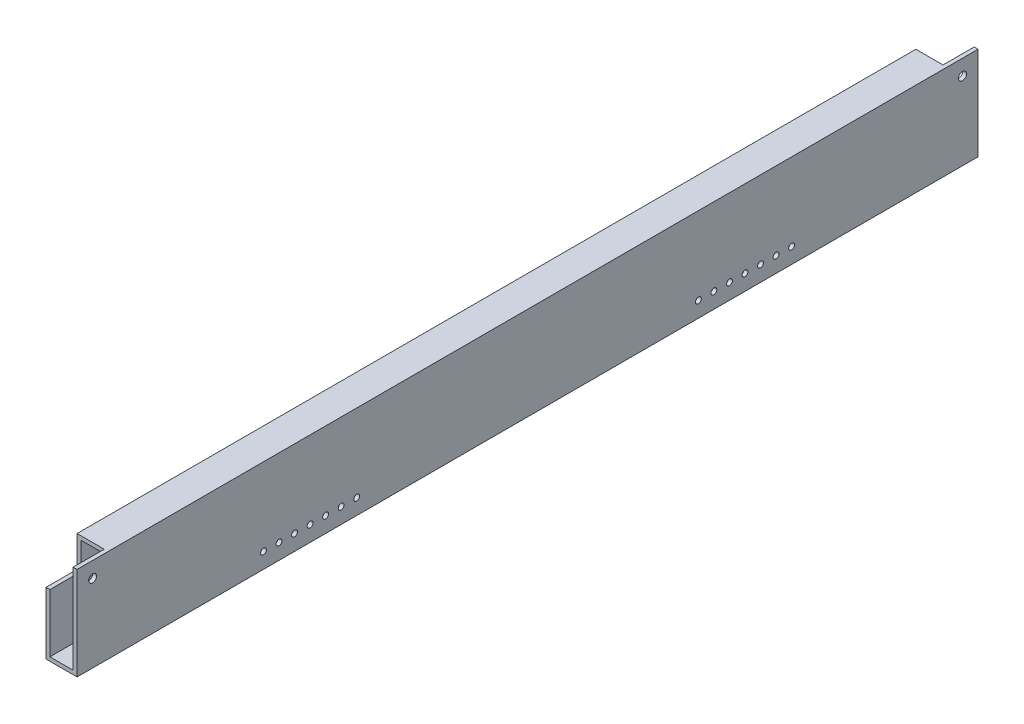
from build123d import *

# Parameters (mm, degrees)
SKETCH1_W           = 25.4
SKETCH1_H           = 76.2
BOSS_EXTRUDE1_DEPTH = 368.3
SHELL1_T            = -3.175
CUT_EXTRUDE2_REACH  = 373.136
SKETCH3_R           = 2.38125
SKETCH4_W           = 25.4
SKETCH4_H           = 25.4
CUT_EXTRUDE3_DEPTH  = 22.225
SKETCH5_R           = 3.25
CUT_EXTRUDE4_DEPTH  = 22.225


with BuildPart() as part:
    # Sketch1 → Boss-Extrude1 (new, symmetric)
    with BuildSketch(Plane.XY):
        Rectangle(SKETCH1_W, SKETCH1_H)
    extrude(amount=BOSS_EXTRUDE1_DEPTH, both=True)

    # Shell1
    shell1_openings = [part.faces().sort_by_distance(p)[0] for p in [
        (0, 0, -368.3),
        (0, 0, 368.3),
    ]]
    offset(amount=SHELL1_T, openings=shell1_openings, kind=Kind.INTERSECTION)

    # Sketch3 → Cut-Extrude2 (cut, up to next)
    with BuildSketch(Plane(origin=(12.7, 0, 0), x_dir=(0, 0, -1), z_dir=(1, 0, 0)), mode=Mode.PRIVATE) as cut_extrude2_sk1:
        with Locations((215.9, -25.4)):
            Circle(SKETCH3_R)
    cut_extrude2_tool1 = extrude(cut_extrude2_sk1.sketch, amount=-CUT_EXTRUDE2_REACH, mode=Mode.PRIVATE) & part.part
    # Sketch3 → Cut-Extrude2 (cut, up to next)
    with BuildSketch(Plane(origin=(12.7, 0, 0), x_dir=(0, 0, -1), z_dir=(1, 0, 0)), mode=Mode.PRIVATE) as cut_extrude2_sk2:
        with Locations((203.2, -25.4)):
            Circle(SKETCH3_R)
    cut_extrude2_tool2 = extrude(cut_extrude2_sk2.sketch, amount=-CUT_EXTRUDE2_REACH, mode=Mode.PRIVATE) & part.part
    # Sketch3 → Cut-Extrude2 (cut, up to next)
    with BuildSketch(Plane(origin=(12.7, 0, 0), x_dir=(0, 0, -1), z_dir=(1, 0, 0)), mode=Mode.PRIVATE) as cut_extrude2_sk3:
        with Locations((190.5, -25.4)):
            Circle(SKETCH3_R)
    cut_extrude2_tool3 = extrude(cut_extrude2_sk3.sketch, amount=-CUT_EXTRUDE2_REACH, mode=Mode.PRIVATE) & part.part
    # Sketch3 → Cut-Extrude2 (cut, up to next)
    with BuildSketch(Plane(origin=(12.7, 0, 0), x_dir=(0, 0, -1), z_dir=(1, 0, 0)), mode=Mode.PRIVATE) as cut_extrude2_sk4:
        with Locations((177.8, -25.4)):
            Circle(SKETCH3_R)
    cut_extrude2_tool4 = extrude(cut_extrude2_sk4.sketch, amount=-CUT_EXTRUDE2_REACH, mode=Mode.PRIVATE) & part.part
    # Sketch3 → Cut-Extrude2 (cut, up to next)
    with BuildSketch(Plane(origin=(12.7, 0, 0), x_dir=(0, 0, -1), z_dir=(1, 0, 0)), mode=Mode.PRIVATE) as cut_extrude2_sk5:
        with Locations((165.1, -25.4)):
            Circle(SKETCH3_R)
    cut_extrude2_tool5 = extrude(cut_extrude2_sk5.sketch, amount=-CUT_EXTRUDE2_REACH, mode=Mode.PRIVATE) & part.part
    # Sketch3 → Cut-Extrude2 (cut, up to next)
    with BuildSketch(Plane(origin=(12.7, 0, 0), x_dir=(0, 0, -1), z_dir=(1, 0, 0)), mode=Mode.PRIVATE) as cut_extrude2_sk6:
        with Locations((152.4, -25.4)):
            Circle(SKETCH3_R)
    cut_extrude2_tool6 = extrude(cut_extrude2_sk6.sketch, amount=-CUT_EXTRUDE2_REACH, mode=Mode.PRIVATE) & part.part
    # Sketch3 → Cut-Extrude2 (cut, up to next)
    with BuildSketch(Plane(origin=(12.7, 0, 0), x_dir=(0, 0, -1), z_dir=(1, 0, 0)), mode=Mode.PRIVATE) as cut_extrude2_sk7:
        with Locations((139.7, -25.4)):
            Circle(SKETCH3_R)
    cut_extrude2_tool7 = extrude(cut_extrude2_sk7.sketch, amount=-CUT_EXTRUDE2_REACH, mode=Mode.PRIVATE) & part.part
    # Sketch3 → Cut-Extrude2 (cut, up to next)
    with BuildSketch(Plane(origin=(12.7, 0, 0), x_dir=(0, 0, -1), z_dir=(1, 0, 0)), mode=Mode.PRIVATE) as cut_extrude2_sk8:
        with Locations((-139.7, -25.4)):
            Circle(SKETCH3_R)
    cut_extrude2_tool8 = extrude(cut_extrude2_sk8.sketch, amount=-CUT_EXTRUDE2_REACH, mode=Mode.PRIVATE) & part.part
    # Sketch3 → Cut-Extrude2 (cut, up to next)
    with BuildSketch(Plane(origin=(12.7, 0, 0), x_dir=(0, 0, -1), z_dir=(1, 0, 0)), mode=Mode.PRIVATE) as cut_extrude2_sk9:
        with Locations((-152.4, -25.4)):
            Circle(SKETCH3_R)
    cut_extrude2_tool9 = extrude(cut_extrude2_sk9.sketch, amount=-CUT_EXTRUDE2_REACH, mode=Mode.PRIVATE) & part.part
    # Sketch3 → Cut-Extrude2 (cut, up to next)
    with BuildSketch(Plane(origin=(12.7, 0, 0), x_dir=(0, 0, -1), z_dir=(1, 0, 0)), mode=Mode.PRIVATE) as cut_extrude2_sk10:
        with Locations((-165.1, -25.4)):
            Circle(SKETCH3_R)
    cut_extrude2_tool10 = extrude(cut_extrude2_sk10.sketch, amount=-CUT_EXTRUDE2_REACH, mode=Mode.PRIVATE) & part.part
    # Sketch3 → Cut-Extrude2 (cut, up to next)
    with BuildSketch(Plane(origin=(12.7, 0, 0), x_dir=(0, 0, -1), z_dir=(1, 0, 0)), mode=Mode.PRIVATE) as cut_extrude2_sk11:
        with Locations((-203.2, -25.4)):
            Circle(SKETCH3_R)
    cut_extrude2_tool11 = extrude(cut_extrude2_sk11.sketch, amount=-CUT_EXTRUDE2_REACH, mode=Mode.PRIVATE) & part.part
    # Sketch3 → Cut-Extrude2 (cut, up to next)
    with BuildSketch(Plane(origin=(12.7, 0, 0), x_dir=(0, 0, -1), z_dir=(1, 0, 0)), mode=Mode.PRIVATE) as cut_extrude2_sk12:
        with Locations((-177.8, -25.4)):
            Circle(SKETCH3_R)
    cut_extrude2_tool12 = extrude(cut_extrude2_sk12.sketch, amount=-CUT_EXTRUDE2_REACH, mode=Mode.PRIVATE) & part.part
    # Sketch3 → Cut-Extrude2 (cut, up to next)
    with BuildSketch(Plane(origin=(12.7, 0, 0), x_dir=(0, 0, -1), z_dir=(1, 0, 0)), mode=Mode.PRIVATE) as cut_extrude2_sk13:
        with Locations((-215.9, -25.4)):
            Circle(SKETCH3_R)
    cut_extrude2_tool13 = extrude(cut_extrude2_sk13.sketch, amount=-CUT_EXTRUDE2_REACH, mode=Mode.PRIVATE) & part.part
    # Sketch3 → Cut-Extrude2 (cut, up to next)
    with BuildSketch(Plane(origin=(12.7, 0, 0), x_dir=(0, 0, -1), z_dir=(1, 0, 0)), mode=Mode.PRIVATE) as cut_extrude2_sk14:
        with Locations((-190.5, -25.4)):
            Circle(SKETCH3_R)
    cut_extrude2_tool14 = extrude(cut_extrude2_sk14.sketch, amount=-CUT_EXTRUDE2_REACH, mode=Mode.PRIVATE) & part.part
    add(cut_extrude2_tool1.solids().sort_by_distance((12.7, -25.4, -215.9))[0], mode=Mode.SUBTRACT)
    add(cut_extrude2_tool2.solids().sort_by_distance((12.7, -25.4, -203.2))[0], mode=Mode.SUBTRACT)
    add(cut_extrude2_tool3.solids().sort_by_distance((12.7, -25.4, -190.5))[0], mode=Mode.SUBTRACT)
    add(cut_extrude2_tool4.solids().sort_by_distance((12.7, -25.4, -177.8))[0], mode=Mode.SUBTRACT)
    add(cut_extrude2_tool5.solids().sort_by_distance((12.7, -25.4, -165.1))[0], mode=Mode.SUBTRACT)
    add(cut_extrude2_tool6.solids().sort_by_distance((12.7, -25.4, -152.4))[0], mode=Mode.SUBTRACT)
    add(cut_extrude2_tool7.solids().sort_by_distance((12.7, -25.4, -139.7))[0], mode=Mode.SUBTRACT)
    add(cut_extrude2_tool8.solids().sort_by_distance((12.7, -25.4, 139.7))[0], mode=Mode.SUBTRACT)
    add(cut_extrude2_tool9.solids().sort_by_distance((12.7, -25.4, 152.4))[0], mode=Mode.SUBTRACT)
    add(cut_extrude2_tool10.solids().sort_by_distance((12.7, -25.4, 165.1))[0], mode=Mode.SUBTRACT)
    add(cut_extrude2_tool11.solids().sort_by_distance((12.7, -25.4, 203.2))[0], mode=Mode.SUBTRACT)
    add(cut_extrude2_tool12.solids().sort_by_distance((12.7, -25.4, 177.8))[0], mode=Mode.SUBTRACT)
    add(cut_extrude2_tool13.solids().sort_by_distance((12.7, -25.4, 215.9))[0], mode=Mode.SUBTRACT)
    add(cut_extrude2_tool14.solids().sort_by_distance((12.7, -25.4, 190.5))[0], mode=Mode.SUBTRACT)

    # Sketch4 → Cut-Extrude3 (cut)
    with BuildSketch(Plane.ZY.offset(12.7)):
        with Locations((-355.6, 25.4)):
            Rectangle(SKETCH4_W, SKETCH4_H)
        with Locations((355.6, 25.4)):
            Rectangle(SKETCH4_W, SKETCH4_H)
    extrude(amount=-CUT_EXTRUDE3_DEPTH, mode=Mode.SUBTRACT)

    # Sketch5 → Cut-Extrude4 (cut)
    with BuildSketch(Plane.ZY.offset(-9.525)):
        with Locations((-355.6, 25.4)):
            Circle(SKETCH5_R)
        with Locations((355.6, 25.4)):
            Circle(SKETCH5_R)
    extrude(amount=-CUT_EXTRUDE4_DEPTH, mode=Mode.SUBTRACT)


solid = part.part
